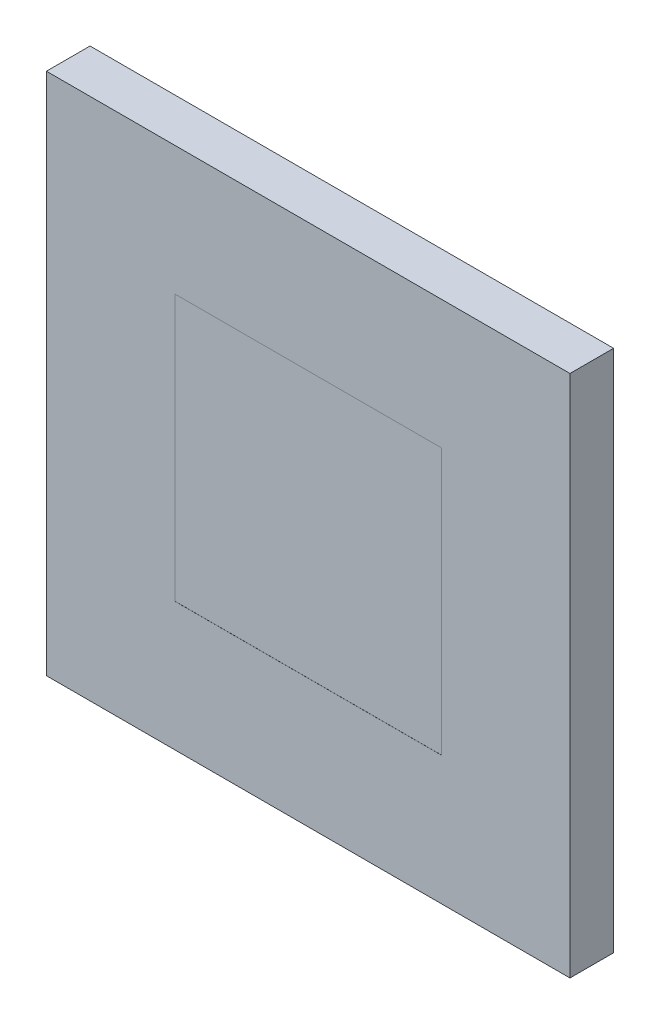
from build123d import *

# Parameters (mm, degrees)
SKETCH1_W           = 600
SKETCH1_H           = 600
BOSS_EXTRUDE1_DEPTH = 50
SKETCH2_W           = 305
SKETCH2_H           = 305
CUT_EXTRUDE1_DEPTH  = 0.1


with BuildPart() as part:
    # Sketch1 → Boss-Extrude1 (new body)
    with BuildSketch(Plane.XY):
        with Locations((300, 300)):
            Rectangle(SKETCH1_W, SKETCH1_H)
    extrude(amount=BOSS_EXTRUDE1_DEPTH)

    # Sketch2 → Cut-Extrude1 (cut)
    with BuildSketch(Plane.XY.offset(50)):
        with Locations((300, 300)):
            Rectangle(SKETCH2_W, SKETCH2_H)
    extrude(amount=-CUT_EXTRUDE1_DEPTH, mode=Mode.SUBTRACT)


solid = part.part
